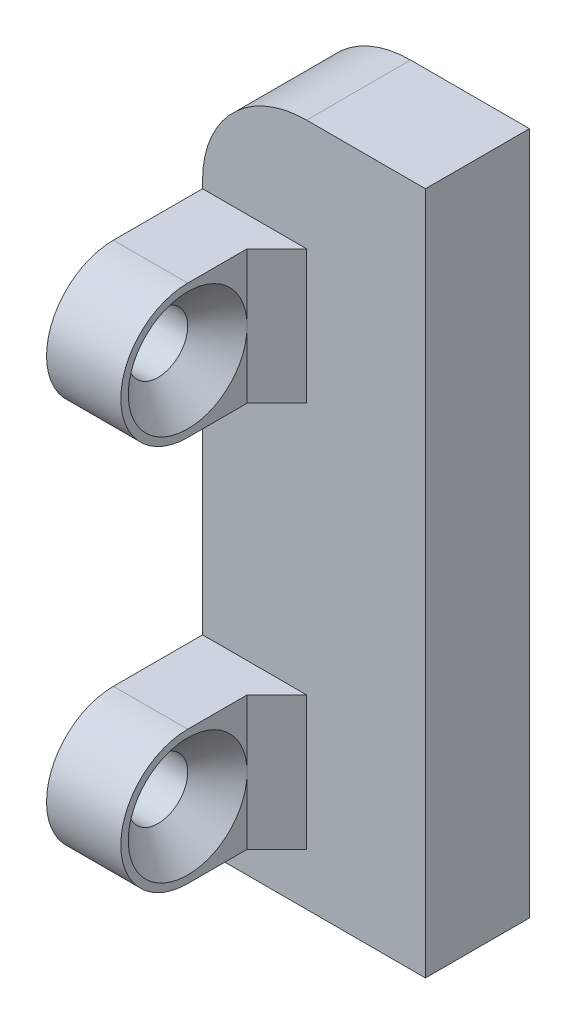
from build123d import *

# Parameters (mm, degrees)
BOSS_EXTRUDE1_DEPTH = 7
SKETCH2_R           = 2
BOSS_EXTRUDE2_DEPTH = 5
CHAMFER1_SIZE       = 2
CHAMFER2_SIZE       = 2


with BuildPart() as part:
    # Sketch1 → Boss-Extrude1 (new body)
    with BuildSketch(Plane.XY):
        with BuildLine():
            Line((22, 21), (14, 21))
            ThreePointArc((14, 21), (9.050252532, 18.949747468), (7, 14))
            Line((7, 14), (7, -25))
            Line((7, -25), (22, -25))
            Line((22, -25), (22, 21))
        make_face()
    extrude(amount=BOSS_EXTRUDE1_DEPTH)

    # Sketch2 → Boss-Extrude2 (add)
    with BuildSketch(Plane.ZY.offset(-7)):
        with BuildLine():
            Line((7, 13.5), (13, 13.5))
            ThreePointArc((13, 13.5), (17.5, 9), (13, 4.5))
            Line((13, 4.5), (7, 4.5))
            Line((7, 4.5), (7, 13.5))
        make_face()
        with Locations(Location((13, 9, 0), (0, 0, 270))):
            Circle(SKETCH2_R, mode=Mode.SUBTRACT)
    boss_extrude2 = extrude(amount=-BOSS_EXTRUDE2_DEPTH)

    # Mirror1: Boss-Extrude2 across plane
    add(boss_extrude2.mirror(Plane.ZX.offset(-4)))

    # Chamfer1
    chamfer1_edges = [part.edges().sort_by_distance(p)[0] for p in [
        (12, 11, 13),
        (12, -19, 13),
    ]]
    chamfer(chamfer1_edges, length=CHAMFER1_SIZE)

    # Chamfer2
    chamfer2_edges = [part.edges().sort_by_distance(p)[0] for p in [
        (12, 9, 7),
        (12, -17, 7),
    ]]
    chamfer(chamfer2_edges, length=CHAMFER2_SIZE - 0.0001)  # a hair under: the kernel refuses the full size


solid = part.part
